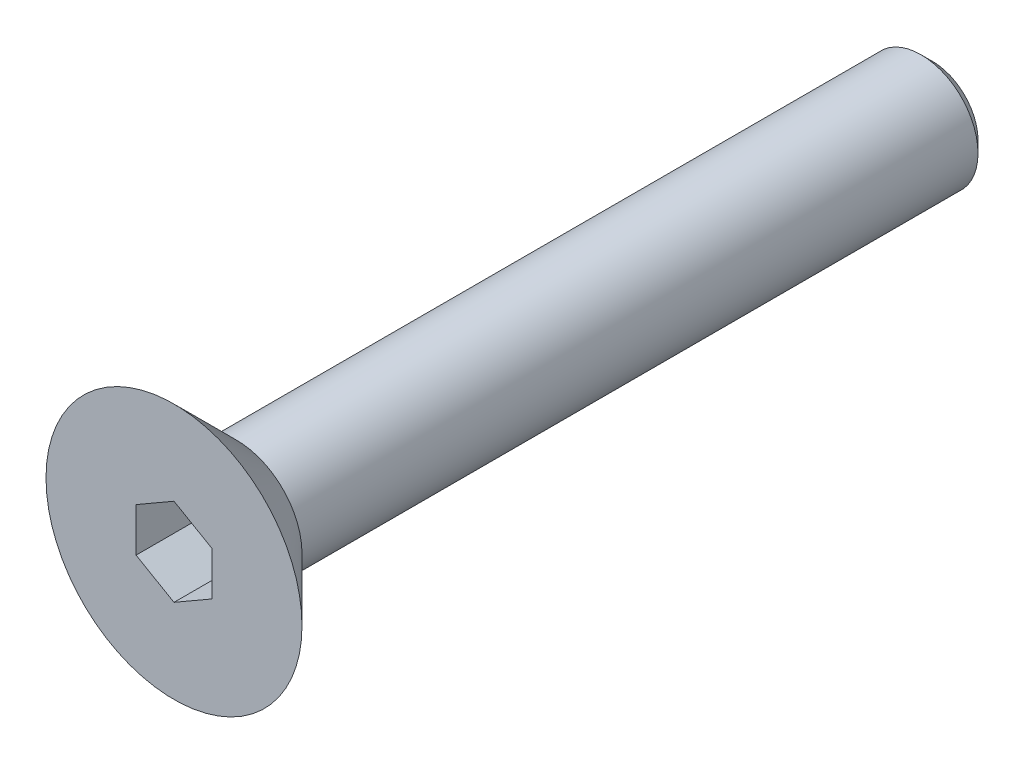
from build123d import *

# Parameters (mm, degrees)
SKETCH1_R           = 3.375
BOSS_EXTRUDE1_DEPTH = 1.65
SKETCH2_R           = 1.5
BOSS_EXTRUDE2_DEPTH = 18.35
CHAMFER1_SIZE       = 0.3
CUT_EXTRUDE1_DEPTH  = 2
CHAMFER2_SIZE       = 1.65


with BuildPart() as part:
    # Sketch1 → Boss-Extrude1 (new body)
    with BuildSketch(Plane.XY):
        Circle(SKETCH1_R)
    extrude(amount=BOSS_EXTRUDE1_DEPTH)

    # Sketch2 → Boss-Extrude2 (add)
    with BuildSketch(Plane(origin=(0, 0, 0), x_dir=(-1, 0, 0), z_dir=(0, 0, -1))):
        with Locations(Location((0, 0, 0), (0, 0, 180))):
            Circle(SKETCH2_R)
    extrude(amount=BOSS_EXTRUDE2_DEPTH)

    # Chamfer1
    chamfer1_edges = [part.edges().sort_by_distance(p)[0] for p in [
        (-1.5, 0, -18.35),
    ]]
    chamfer(chamfer1_edges, length=CHAMFER1_SIZE)

    # Sketch3 → Cut-Extrude1 (cut)
    with BuildSketch(Plane.XY.offset(1.65)):
        Polygon((0, 1.154700538), (-1, 0.577350269), (-1, -0.577350269), (0, -1.154700538), (1, -0.577350269), (1, 0.577350269), align=None)
    extrude(amount=-CUT_EXTRUDE1_DEPTH, mode=Mode.SUBTRACT)

    # Chamfer2
    chamfer2_edges = [part.edges().sort_by_distance(p)[0] for p in [
        (-3.375, 0, 0),
    ]]
    chamfer(chamfer2_edges, length=CHAMFER2_SIZE - 0.0001)  # a hair under: the kernel refuses the full size


solid = part.part
